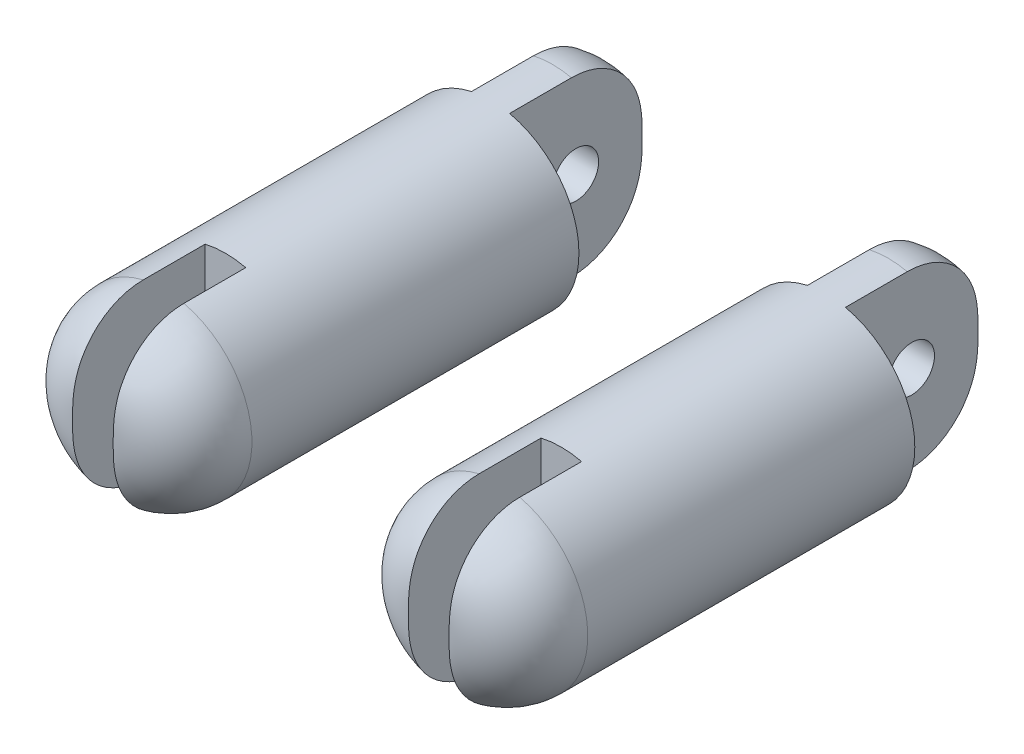
from build123d import *

# Parameters (mm, degrees)
SKETCH1_R                       = 100
BOSS_EXTRUDE1_DEPTH             = 600
BOSS_EXTRUDE1_2_DEPTH           = 600
FILLET1_R                       = 80
FILLET2_R                       = 80
SKETCH2_W                       = 46
SKETCH2_H                       = 231.861905776
CUT_EXTRUDE1_DEPTH              = 150
BOSS_EXTRUDE2_REACH             = 776.811
SKETCH3_R                       = 20.155129503
BOSS_EXTRUDE2_DIRECTION_2_REACH = 776.811
CUT_EXTRUDE2_DEPTH              = 150
FILLET3_R                       = 80
FILLET4_R                       = 80
SKETCH5_R                       = 25.736273229
CUT_EXTRUDE3_DEPTH              = 520


with BuildPart() as part:
    # Sketch1 → Boss-Extrude1 (new body)
    with BuildSketch(Plane.XY):
        with Locations((147.567567568, 0)):
            Circle(SKETCH1_R)
    extrude(amount=BOSS_EXTRUDE1_DEPTH)

    # Fillet2
    fillet2_edges = [part.edges().sort_by_distance(p)[0] for p in [
        (47.567567568, 0, 600),
    ]]
    fillet(fillet2_edges, radius=FILLET2_R)


with BuildPart() as body_2:
    # Sketch1 → Boss-Extrude1 2 (new body)
    with BuildSketch(Plane.XY):
        with Locations((-232.432432432, 0)):
            Circle(SKETCH1_R)
    extrude(amount=BOSS_EXTRUDE1_2_DEPTH)

    # Fillet1
    fillet1_edges = [body_2.edges().sort_by_distance(p)[0] for p in [
        (-332.432432432, 0, 600),
    ]]
    fillet(fillet1_edges, radius=FILLET1_R)


with BuildPart() as cut_extrude1_tool:
    # Sketch2 → Cut-Extrude1 (new body)
    with BuildSketch(Plane.XY.offset(600)):
        with Locations((-232.432432432, 0)):
            Rectangle(SKETCH2_W, SKETCH2_H)
        with Locations((147.567567568, 0)):
            Rectangle(SKETCH2_W, SKETCH2_H)
    extrude(amount=-CUT_EXTRUDE1_DEPTH)


with BuildPart() as part_1:
    add(part.part)

    # Cut-Extrude1: cut by cut_extrude1_tool
    add(cut_extrude1_tool.part, mode=Mode.SUBTRACT)


with BuildPart() as body_2_1:
    add(body_2.part)

    # Cut-Extrude1: cut by cut_extrude1_tool
    add(cut_extrude1_tool.part, mode=Mode.SUBTRACT)

    # Boss-Extrude2: up to this face of the body (flat: up to its plane)
    boss_extrude2_end = Plane(body_2_1.part.faces().sort_by_distance((-209.432432432, 0, 518.696543055))[0])
    # Sketch3 → Boss-Extrude2 (add, up to the picked face)
    with BuildSketch(Plane(origin=(-232.432432432, 0, 0), x_dir=(0, 0, -1), z_dir=(1, 0, 0)), mode=Mode.PRIVATE) as boss_extrude2_sk1:
        with Locations(Location((-524.951093161, 0, 0), (0, 0, 180))):
            Circle(SKETCH3_R)
    boss_extrude2_tool1 = split(extrude(boss_extrude2_sk1.sketch, amount=BOSS_EXTRUDE2_REACH, mode=Mode.PRIVATE), bisect_by=boss_extrude2_end, keep=Keep.BOTH, mode=Mode.PRIVATE)
    add(boss_extrude2_tool1.solids().sort_by(Axis((-232.432432, 0, 524.951093), (1, 0, 0)))[0])

    # Boss-Extrude2 direction 2: up to this face of the body (flat: up to its plane)
    boss_extrude2_direction_2_end = Plane(body_2_1.part.faces().sort_by_distance((-255.432432432, -2.096e-06, 518.696527132))[0])
    # Sketch3 → Boss-Extrude2 direction 2 (add, up to the picked face)
    with BuildSketch(Plane(origin=(-232.432432432, 0, 0), x_dir=(0, 0, -1), z_dir=(1, 0, 0)), mode=Mode.PRIVATE) as boss_extrude2_direction_2_sk1:
        with Locations(Location((-524.951093161, 0, 0), (0, 0, 180))):
            Circle(SKETCH3_R)
    boss_extrude2_direction_2_tool1 = split(extrude(boss_extrude2_direction_2_sk1.sketch, amount=-BOSS_EXTRUDE2_DIRECTION_2_REACH, mode=Mode.PRIVATE), bisect_by=boss_extrude2_direction_2_end, keep=Keep.BOTH, mode=Mode.PRIVATE)
    add(boss_extrude2_direction_2_tool1.solids().sort_by(Axis((-232.432432, 0, 524.951093), (-1, 0, 0)))[0])


with BuildPart() as cut_extrude2_tool:
    # Sketch4 → Cut-Extrude2 (new body)
    with BuildSketch(Plane(origin=(0, 0, 0), x_dir=(-1, 0, 0), z_dir=(0, 0, -1))):
        with BuildLine():
            Line((253.946747543, 97.658252315), (253.946747543, -97.658252315))
            ThreePointArc((253.946747543, -97.658252315), (310.379310212, -62.644107819), (332.432432432, 0))
            ThreePointArc((332.432432432, 0), (310.379310212, 62.644107819), (253.946747543, 97.658252315))
        make_face()
        with BuildLine():
            ThreePointArc((210.918117322, 97.658252315), (132.432432432, 0), (210.918117322, -97.658252315))
            Line((210.918117322, -97.658252315), (210.918117322, 97.658252315))
        make_face()
        with BuildLine():
            Line((-126.053252457, 97.658252315), (-126.053252457, -97.658252315))
            ThreePointArc((-126.053252457, -97.658252315), (-69.620689788, -62.644107819), (-47.567567568, 0))
            ThreePointArc((-47.567567568, 0), (-69.620689788, 62.644107819), (-126.053252457, 97.658252315))
        make_face()
        with BuildLine():
            ThreePointArc((-169.081882678, 97.658252315), (-247.567567568, 0), (-169.081882678, -97.658252315))
            Line((-169.081882678, -97.658252315), (-169.081882678, 97.658252315))
        make_face()
    extrude(amount=-CUT_EXTRUDE2_DEPTH)


with BuildPart() as part_2:
    add(part_1.part)

    # Cut-Extrude2: cut by cut_extrude2_tool
    add(cut_extrude2_tool.part, mode=Mode.SUBTRACT)

    # Fillet3
    # the kernel refuses this fillet: 80 mm, written as the material it takes off along each edge
    with BuildSketch(Plane(origin=(147.567567568, 0, 0), x_dir=(-0.7984359735160291, 0.6020797257801586, 0), z_dir=(0.6020797257801586, 0.7984359735160291, 0))) as fillet3_piece_1:
        with BuildLine():
            CenterArc((100 - FILLET3_R, FILLET3_R), FILLET3_R, 270, 90)
            Line((100 - FILLET3_R, 0), (100, 0))
            Line((100, 0), (100, FILLET3_R))
        make_face()
    revolve(axis=Axis((147.567567568, 0, 0), (0, 0, 1)), revolution_arc=254.037985384, mode=Mode.SUBTRACT)
    with BuildSketch(Plane(origin=(147.567567568, 0, 0), x_dir=(0.7984359735160301, -0.6020797257801572, 0), z_dir=(-0.6020797257801572, -0.7984359735160301, 0))) as fillet3_piece_2:
        with BuildLine():
            CenterArc((100 - FILLET3_R, FILLET3_R), FILLET3_R, 270, 90)
            Line((100 - FILLET3_R, 0), (100, 0))
            Line((100, 0), (100, FILLET3_R))
        make_face()
    revolve(axis=Axis((147.567567568, 0, 0), (0, 0, 1)), revolution_arc=254.037985384, mode=Mode.SUBTRACT)


with BuildPart() as body_2_2:
    add(body_2_1.part)

    # Cut-Extrude2: cut by cut_extrude2_tool
    add(cut_extrude2_tool.part, mode=Mode.SUBTRACT)

    # Fillet4
    # the kernel refuses this fillet: 80 mm, written as the material it takes off along each edge
    with BuildSketch(Plane(origin=(-232.432432432, 0, 0), x_dir=(-0.79843597351603, 0.6020797257801571, 0), z_dir=(0.6020797257801571, 0.79843597351603, 0))) as fillet4_piece_1:
        with BuildLine():
            CenterArc((100 - FILLET4_R, FILLET4_R), FILLET4_R, 270, 90)
            Line((100 - FILLET4_R, 0), (100, 0))
            Line((100, 0), (100, FILLET4_R))
        make_face()
    revolve(axis=Axis((-232.432432432, 0, 0), (0, 0, 1)), revolution_arc=254.037985384, mode=Mode.SUBTRACT)
    with BuildSketch(Plane(origin=(-232.432432432, 0, 0), x_dir=(0.7984359735160307, -0.6020797257801567, 0), z_dir=(-0.6020797257801567, -0.7984359735160307, 0))) as fillet4_piece_2:
        with BuildLine():
            CenterArc((100 - FILLET4_R, FILLET4_R), FILLET4_R, 270, 90)
            Line((100 - FILLET4_R, 0), (100, 0))
            Line((100, 0), (100, FILLET4_R))
        make_face()
    revolve(axis=Axis((-232.432432432, 0, 0), (0, 0, 1)), revolution_arc=254.037985384, mode=Mode.SUBTRACT)


with BuildPart() as cut_extrude3_tool:
    # Sketch5 → Cut-Extrude3 (new body)
    with BuildSketch(Plane(origin=(169.081882678, 0, 0), x_dir=(0, 0, -1), z_dir=(1, 0, 0))):
        with Locations(Location((-75, 0, 0), (0, 0, 180))):
            Circle(SKETCH5_R)
    extrude(amount=-CUT_EXTRUDE3_DEPTH)


with BuildPart() as part_3:
    add(part_2.part)

    # Cut-Extrude3: cut by cut_extrude3_tool
    add(cut_extrude3_tool.part, mode=Mode.SUBTRACT)


with BuildPart() as body_2_3:
    add(body_2_2.part)

    # Cut-Extrude3: cut by cut_extrude3_tool
    add(cut_extrude3_tool.part, mode=Mode.SUBTRACT)


solid = Compound([part_3.part, body_2_3.part])
